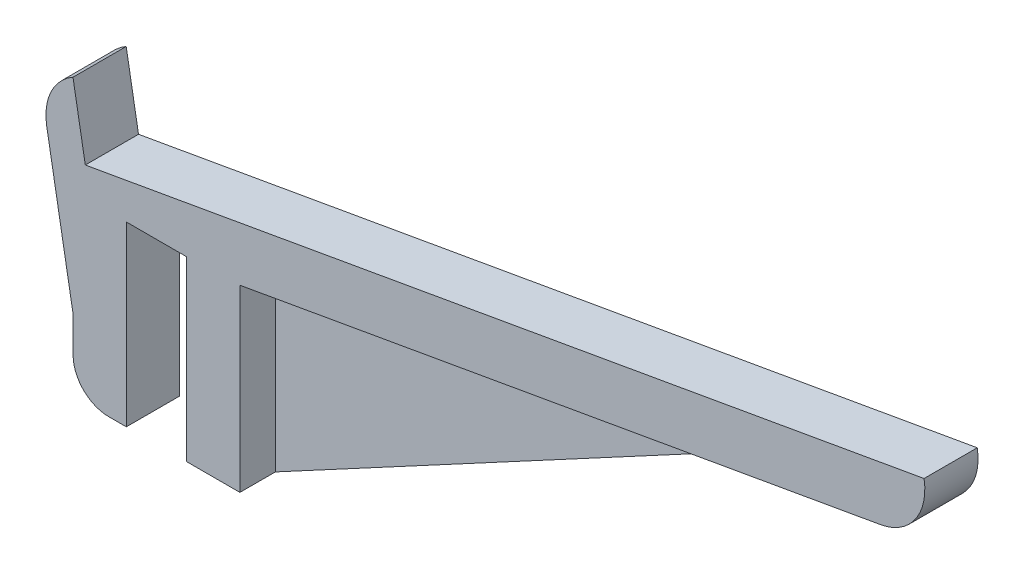
from build123d import *

# Parameters (mm, degrees)
BOSS_EXTRUDE1_DEPTH = 15
BOSS_EXTRUDE2_DEPTH = 5
FILLET1_R           = 15
FILLET2_R           = 10
FILLET3_R           = 15


# Some blends are built 0.0001 mm under size
with BuildPart() as part:
    # Sketch1 → Boss-Extrude1 (new body)
    with BuildSketch(Plane.XY):
        Polygon((0, 0), (0, -50), (15, -50), (15, 0.565330323), (210.392182336, 35.018243889), (207.787459671, 49.790360184), (-28.566401052, 8.114797544), (-32.039364606, 27.810952604), (-41.887442136, 26.074470827), (-32, -30), (-32, -50), (-17, -50), (-17, 0), align=None)
    extrude(amount=BOSS_EXTRUDE1_DEPTH)

    # Sketch2 → Boss-Extrude2 (add)
    with BuildSketch(Plane.XY):
        Polygon((15, -50), (154.906481174, 25.23461773), (15, 0.565330323), align=None)
    extrude(amount=BOSS_EXTRUDE2_DEPTH)

    # Fillet1
    # the kernel refuses this fillet: 15 mm, written as the material it takes off along each edge
    with BuildSketch(Plane(origin=(-41.887442136, 26.074470827, -35.355339059), x_dir=(0.9848077530122078, 0.17364817766693189, 0), z_dir=(0, 0, 1))) as fillet1_piece_1:
        with BuildLine():
            CenterArc((15, -14.142135624), FILLET1_R, 109.471220634, 70.528779366)
            Line((0, -14.142135624), (-0.3, -14.142135624))
            Line((-0.3, -14.142135624), (-0.3, 0))
            Line((-0.3, 0), (0, 0.3))
            ThreePointArc((0, 0.3), (5, 0.3), (9.9, 0.282842712))
            Line((9.9, 0.282842712), (10, 0))
        make_face()
    extrude(amount=85.710678119, mode=Mode.SUBTRACT)

    # Fillet2
    fillet2_edges = [part.edges().sort_by_distance(p)[0] for p in [
        (-32, -50, 7.5),
    ]]
    fillet(fillet2_edges, radius=FILLET2_R)

    # Fillet3
    fillet3_edges = [part.edges().sort_by_distance(p)[0] for p in [
        (210.392182336, 35.018243889, 7.5),
    ]]
    fillet(fillet3_edges, radius=FILLET3_R - 0.0001)  # a hair under: the kernel refuses the full size


solid = part.part
